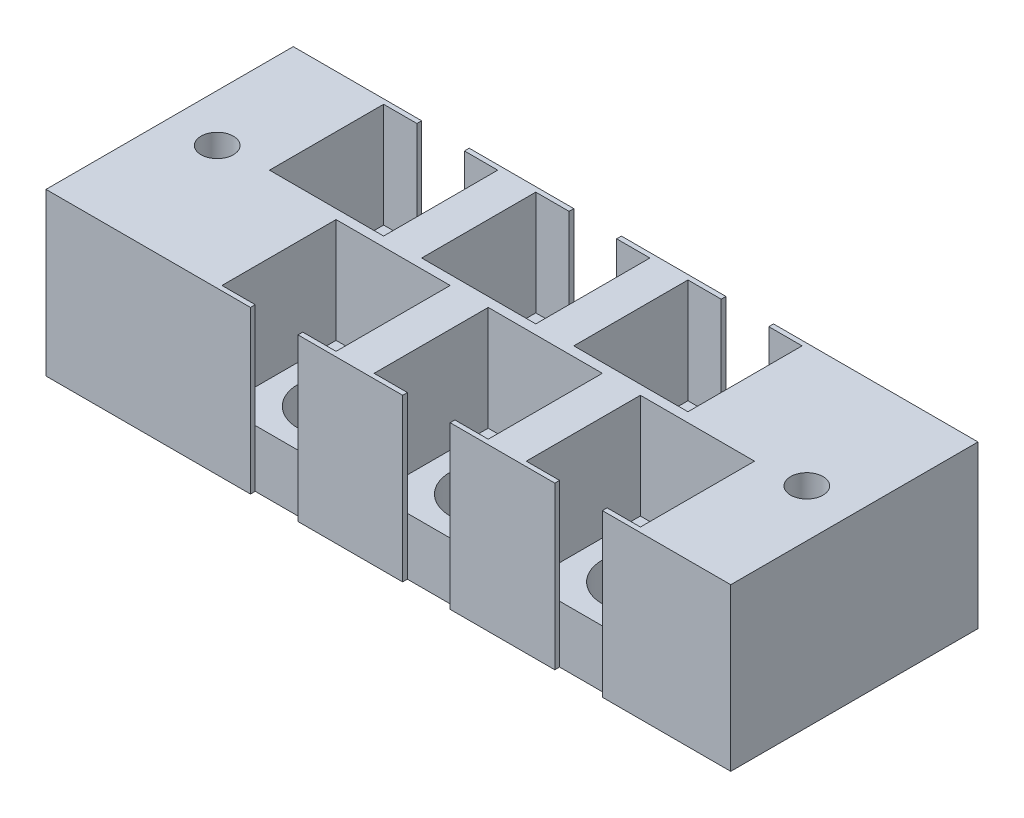
from build123d import *

# Parameters (mm, degrees)
SKETCH1_W             = 12
SKETCH1_H             = 12
SKETCH1_R             = 4
BOSS_EXTRUDE1_DEPTH   = 6
BOSS_EXTRUDE1_2_DEPTH = 6
BOSS_EXTRUDE1_3_DEPTH = 6
BOSS_EXTRUDE1_4_DEPTH = 6
BOSS_EXTRUDE1_5_DEPTH = 6
BOSS_EXTRUDE1_6_DEPTH = 6
SKETCH1_3_R           = 1.7
BOSS_EXTRUDE2_DEPTH   = 17
SKETCH2_W             = 2.2
SKETCH2_H             = 5.000000011
SKETCH2_H_2           = 5.00000001
BOSS_EXTRUDE3_DEPTH   = 7
CUT_EXTRUDE1_DEPTH    = 1


with BuildPart() as part:
    # Sketch1 → Boss-Extrude1 (new body)
    with BuildSketch(Plane(origin=(0, 0, 0), x_dir=(1, 0, 0), z_dir=(0, 1, 0))):
        with Locations((-3.313604998, -10.664874546)):
            Rectangle(SKETCH1_W, SKETCH1_H)
        with Locations((-3.313604998, -10.664874546)):
            Circle(SKETCH1_R, mode=Mode.SUBTRACT)
    extrude(amount=BOSS_EXTRUDE1_DEPTH)



with BuildPart() as body_2:
    # Sketch1 → Boss-Extrude1 2 (new body)
    with BuildSketch(Plane(origin=(0, 0, 0), x_dir=(1, 0, 0), z_dir=(0, 1, 0))):
        with Locations((12.686395002, -10.664873855)):
            Rectangle(SKETCH1_W, SKETCH1_H)
        with Locations((12.686395002, -10.664873855)):
            Circle(SKETCH1_R, mode=Mode.SUBTRACT)
    extrude(amount=BOSS_EXTRUDE1_2_DEPTH)


with BuildPart() as body_3:
    # Sketch1 → Boss-Extrude1 3 (new body)
    with BuildSketch(Plane(origin=(0, 0, 0), x_dir=(1, 0, 0), z_dir=(0, 1, 0))):
        with Locations((4.686395002, -23.66487344)):
            Rectangle(SKETCH1_W, SKETCH1_H)
        with Locations((4.686395002, -23.66487344)):
            Circle(SKETCH1_R, mode=Mode.SUBTRACT)
    extrude(amount=BOSS_EXTRUDE1_3_DEPTH)


with BuildPart() as body_4:
    # Sketch1 → Boss-Extrude1 4 (new body)
    with BuildSketch(Plane(origin=(0, 0, 0), x_dir=(1, 0, 0), z_dir=(0, 1, 0))):
        with Locations((20.686395002, -23.664873826)):
            Rectangle(SKETCH1_W, SKETCH1_H)
        with Locations((20.686395002, -23.664873826)):
            Circle(SKETCH1_R, mode=Mode.SUBTRACT)
    extrude(amount=BOSS_EXTRUDE1_4_DEPTH)


with BuildPart() as body_5:
    # Sketch1 → Boss-Extrude1 5 (new body)
    with BuildSketch(Plane(origin=(0, 0, 0), x_dir=(1, 0, 0), z_dir=(0, 1, 0))):
        with Locations((28.686395002, -10.664873798)):
            Rectangle(SKETCH1_W, SKETCH1_H)
        with Locations((28.686395002, -10.664873798)):
            Circle(SKETCH1_R, mode=Mode.SUBTRACT)
    extrude(amount=BOSS_EXTRUDE1_5_DEPTH)


with BuildPart() as body_6:
    # Sketch1 → Boss-Extrude1 6 (new body)
    with BuildSketch(Plane(origin=(0, 0, 0), x_dir=(1, 0, 0), z_dir=(0, 1, 0))):
        with Locations((36.686395002, -23.664873963)):
            Rectangle(SKETCH1_W, SKETCH1_H)
        with Locations((36.686395002, -23.664873963)):
            Circle(SKETCH1_R, mode=Mode.SUBTRACT)
    extrude(amount=BOSS_EXTRUDE1_6_DEPTH)


with BuildPart() as part_1:
    add(part.part)

    add(body_2.part)  # Boss-Extrude2 merges body 2

    add(body_3.part)  # Boss-Extrude2 merges body 3

    add(body_4.part)  # Boss-Extrude2 merges body 4

    add(body_5.part)  # Boss-Extrude2 merges body 5

    add(body_6.part)  # Boss-Extrude2 merges body 6
    # Sketch1<3> → Boss-Extrude2 (add)
    with BuildSketch(Plane(origin=(0, 0, 0), x_dir=(1, 0, 0), z_dir=(0, 1, 0))):
        Polygon((6.186395002, -4.164873855), (3.186395002, -4.164874546), (-0.813604998, -4.164874546), (-0.813604998, -4.664874546), (2.686395002, -4.664874546), (2.686395002, -16.664874546), (-9.313604998, -16.664874546), (-9.313604998, -4.664874546), (-5.813604998, -4.664874546), (-5.813604998, -4.164874546), (-19.313604998, -4.164874546), (-19.313604998, -30.16487344), (2.186395002, -30.16487344), (2.186395002, -29.66487344), (-1.313604998, -29.66487344), (-1.313604998, -17.66487344), (10.686395002, -17.66487344), (10.686395002, -29.66487344), (7.186395002, -29.66487344), (7.186395002, -30.16487344), (11.186395002, -30.16487344), (14.186395002, -30.164873826), (18.186395002, -30.164873826), (18.186395002, -29.664873826), (14.686395002, -29.664873826), (14.686395002, -17.664873826), (26.686395002, -17.664873826), (26.686395002, -29.664873826), (23.186395002, -29.664873826), (23.186395002, -30.164873826), (27.186395002, -30.164873826), (30.186395002, -30.164873963), (34.186395002, -30.164873963), (34.186395002, -29.664873963), (30.686395002, -29.664873963), (30.686395002, -17.664873963), (42.686395002, -17.664873963), (42.686395002, -29.664873963), (39.186395002, -29.664873963), (39.186395002, -30.164873963), (43.186395002, -30.164873963), (52.686395002, -30.16487344), (52.686395002, -4.164874546), (35.186395002, -4.164873798), (31.186395002, -4.164873798), (31.186395002, -4.664873798), (34.686395002, -4.664873798), (34.686395002, -16.664873798), (22.686395002, -16.664873798), (22.686395002, -4.664873798), (26.186395002, -4.664873798), (26.186395002, -4.164873798), (22.186395002, -4.164873798), (19.186395002, -4.164873855), (15.186395002, -4.164873855), (15.186395002, -4.664873855), (18.686395002, -4.664873855), (18.686395002, -16.664873855), (6.686395002, -16.664873855), (6.686395002, -4.664873855), (10.186395002, -4.664873855), (10.186395002, -4.164873855), align=None)
        with Locations((-14.313604998, -17.164873993)):
            Circle(SKETCH1_3_R, mode=Mode.SUBTRACT)
        with Locations((47.686395002, -17.164873993)):
            Circle(SKETCH1_3_R, mode=Mode.SUBTRACT)
    extrude(amount=BOSS_EXTRUDE2_DEPTH)

    # Sketch2 → Boss-Extrude3 (add)
    with BuildSketch(Plane.XZ):
        with Locations((0.286395002, 17.164875484)):
            Rectangle(SKETCH2_W, SKETCH2_H)
        with Locations((9.086395002, 17.164872919)):
            Rectangle(SKETCH2_W, SKETCH2_H_2)
        with Locations((16.286395002, 17.164872919)):
            Rectangle(SKETCH2_W, SKETCH2_H_2)
        with Locations((25.086395002, 17.164870999)):
            Rectangle(SKETCH2_W, SKETCH2_H_2)
        with Locations((32.286395002, 17.164870999)):
            Rectangle(SKETCH2_W, SKETCH2_H_2)
    extrude(amount=BOSS_EXTRUDE3_DEPTH)

    # Sketch3 → Cut-Extrude1 (cut)
    # profile 1 of 2: a face of its own
    with BuildSketch(Plane.XZ):
        Polygon((-9.398255556, 27.603725947), (-7.851460684, 27.603725947), (-7.851460684, 27.278084921), (-9.113319659, 27.278084921), (-9.113319659, 26.301161844), (-7.851460684, 26.301161844), (-7.851460684, 25.975520819), (-9.113319659, 25.975520819), (-9.113319659, 24.428725947), (-9.398255556, 24.428725947), align=None)
    # profile 2 of 2: a face of its own
    with BuildSketch(Plane.XZ):
        with BuildLine():
            Line((-6.101140171, 27.685136203), (-5.881078072, 27.512775426))
            Line((-5.881078072, 27.512775426), (-6.719985324, 26.22992787))
            add(Edge.make_bspline(
                [(-6.719985324, 26.22992787), (-6.664132287, 26.238830444), (-6.555184623, 26.25619592), (-6.444906986, 26.259060628), (-6.39116421, 26.260456716)],
                knots=[0, 0, 0, 0, 1.025318673, 2, 2, 2, 2], degree=3))
            add(Edge.make_bspline(
                [(-6.39116421, 26.260456716), (-6.35889325, 26.259601948), (-6.295578934, 26.257924928), (-6.202547412, 26.244671952), (-6.113132706, 26.224043768), (-6.027534286, 26.193853167), (-5.945643518, 26.155299567), (-5.866992134, 26.109090163), (-5.793058147, 26.05284231), (-5.722889583, 25.990009056), (-5.659183571, 25.920415803), (-5.602781007, 25.846573159), (-5.555403846, 25.768558075), (-5.516964646, 25.686410061), (-5.48711522, 25.600255747), (-5.465354999, 25.510205363), (-5.452492083, 25.416196814), (-5.450745388, 25.352263041), (-5.44985812, 25.319786644)],
                knots=[0, 0, 0, 0, 1.044136307, 2.048553127, 3.035567123, 4.010001674, 4.980053131, 5.96154148, 6.956538004, 7.981742224, 9.006487041, 10.005615874, 10.984750588, 11.954802044, 12.935714515, 13.930994945, 14.949008866, 16, 16, 16, 16], degree=3))
            add(Edge.make_bspline(
                [(-5.44985812, 25.319786644), (-5.45114908, 25.275355055), (-5.453689382, 25.187924204), (-5.479002111, 25.060582478), (-5.518335504, 24.939267981), (-5.574557976, 24.825917605), (-5.644391995, 24.720686702), (-5.729552382, 24.627445601), (-5.827018975, 24.544287782), (-5.937224856, 24.474749277), (-6.055827402, 24.417959367), (-6.180425286, 24.377169469), (-6.309808483, 24.352056607), (-6.397624092, 24.348908275), (-6.44204562, 24.347315691)],
                knots=[0, 0, 0, 0, 1.031375318, 2.029502543, 3.004789286, 3.987476834, 4.960371455, 5.9300674, 6.912260825, 7.929083631, 8.949397511, 9.960523116, 10.96833055, 12, 12, 12, 12], degree=3))
            add(Edge.make_bspline(
                [(-6.44204562, 24.347315691), (-6.484769056, 24.348701991), (-6.569396701, 24.351448011), (-6.69388645, 24.375909969), (-6.813505045, 24.415558555), (-6.927414412, 24.470181508), (-7.032933825, 24.539176873), (-7.127336224, 24.62223694), (-7.210150905, 24.717586241), (-7.27907074, 24.825209984), (-7.333734018, 24.940861589), (-7.374727736, 25.061454581), (-7.398672899, 25.186549564), (-7.402018947, 25.271350312), (-7.403704274, 25.314062485)],
                knots=[0, 0, 0, 0, 1.012016664, 2.004627821, 2.994792927, 3.992885782, 4.990978636, 5.973936114, 6.964471063, 7.975201453, 8.993600317, 9.990122807, 10.98767138, 12, 12, 12, 12], degree=3))
            add(Edge.make_bspline(
                [(-7.403704274, 25.314062485), (-7.402632535, 25.346760072), (-7.400444248, 25.413522295), (-7.385164886, 25.514636092), (-7.360613251, 25.618096716), (-7.333117528, 25.705866592), (-7.304065724, 25.777768115), (-7.279888063, 25.83573771), (-7.24979451, 25.895392398), (-7.2177058, 25.958777768), (-7.180733497, 26.024260268), (-7.140532872, 26.092934311), (-7.095992475, 26.163707716), (-7.06476847, 26.211735665), (-7.048806437, 26.236288046)],
                knots=[0, 0, 0, 0, 1.173818275, 2.396712641, 3.66331629, 4.989737886, 5.693666774, 6.447286557, 7.243889047, 8.091586357, 8.998013824, 9.943181721, 10.948533338, 12, 12, 12, 12], degree=3))
            Line((-7.048806437, 26.236288046), (-6.101140171, 27.685136203))
        make_face()
        with BuildLine():
            add(Edge.make_bspline(
                [(-6.450949867, 25.934815691), (-6.475135558, 25.934100528), (-6.522587686, 25.932697384), (-6.592119241, 25.924772831), (-6.657747726, 25.909756715), (-6.720227068, 25.890337031), (-6.778890376, 25.863880994), (-6.834464891, 25.832179146), (-6.886310979, 25.794197549), (-6.934175557, 25.751320613), (-6.977549888, 25.704333064), (-7.014908341, 25.654016471), (-7.0471319, 25.601570163), (-7.073331923, 25.546559408), (-7.093733611, 25.489004329), (-7.108491245, 25.429169877), (-7.116704289, 25.366654754), (-7.118070657, 25.324261698), (-7.118768377, 25.302614168)],
                knots=[0, 0, 0, 0, 1.128956033, 2.215002439, 3.259141796, 4.2666399, 5.263148119, 6.255916712, 7.247353359, 8.256307737, 9.250603402, 10.226115518, 11.176314381, 12.118911324, 13.063945463, 14.021379252, 14.989639887, 16, 16, 16, 16], degree=3))
            add(Edge.make_bspline(
                [(-7.118768377, 25.302614168), (-7.118200177, 25.281160258), (-7.117086023, 25.239092334), (-7.106969276, 25.177098935), (-7.091516022, 25.117440768), (-7.068528663, 25.060425389), (-7.041108558, 25.005183729), (-7.004908728, 24.95371672), (-6.964797786, 24.902898514), (-6.916851718, 24.856632893), (-6.865395525, 24.813582956), (-6.810421577, 24.77595444), (-6.75312647, 24.743763411), (-6.69273668, 24.718534773), (-6.630109003, 24.697829884), (-6.564721643, 24.683259828), (-6.496529125, 24.675022493), (-6.450335652, 24.673654346), (-6.426781197, 24.672956716)],
                knots=[0, 0, 0, 0, 0.989467248, 1.94019797, 2.891935182, 3.827694429, 4.772920941, 5.730924762, 6.725747692, 7.756678648, 8.79901574, 9.819492441, 10.826891316, 11.826466727, 12.835195252, 13.867842842, 14.912794438, 16, 16, 16, 16], degree=3))
            add(Edge.make_bspline(
                [(-6.426781197, 24.672956716), (-6.403226781, 24.673654401), (-6.357033384, 24.675022655), (-6.288840316, 24.683259212), (-6.223454985, 24.697832143), (-6.160819937, 24.718526584), (-6.100457354, 24.743793787), (-6.043212356, 24.775754172), (-5.9887583, 24.813814364), (-5.937268327, 24.856559324), (-5.889521826, 24.90316184), (-5.848448866, 24.953263088), (-5.813357647, 25.005599693), (-5.784842349, 25.060207779), (-5.762108178, 25.117475243), (-5.746576561, 25.177089699), (-5.736480706, 25.239094751), (-5.735363681, 25.281161074), (-5.734794018, 25.302614168)],
                knots=[0, 0, 0, 0, 1.087397944, 2.132534446, 3.165364764, 4.174271784, 5.174024072, 6.181601208, 7.194203697, 8.236725232, 9.267838612, 10.269026844, 11.221737037, 12.171628256, 13.107553087, 14.05945871, 15.010357665, 16, 16, 16, 16], degree=3))
            add(Edge.make_bspline(
                [(-5.734794018, 25.302614168), (-5.735293213, 25.324289938), (-5.73627297, 25.366832426), (-5.747354571, 25.429141922), (-5.762723759, 25.489308307), (-5.785931097, 25.546953757), (-5.816081867, 25.601849602), (-5.852804263, 25.654277717), (-5.895295301, 25.704622251), (-5.944341412, 25.751441048), (-5.997731854, 25.793933192), (-6.05413902, 25.832321734), (-6.113913967, 25.863585902), (-6.175978195, 25.890427016), (-6.24107925, 25.909448889), (-6.308506046, 25.924819714), (-6.378897492, 25.932631138), (-6.426766329, 25.934082471), (-6.450949867, 25.934815691)],
                knots=[0, 0, 0, 0, 0.978753431, 1.920974676, 2.853199117, 3.782215702, 4.721507756, 5.67862441, 6.671401678, 7.694929396, 8.738190014, 9.75360867, 10.774035531, 11.783329636, 12.805060902, 13.835252836, 14.906360638, 16, 16, 16, 16], degree=3))
        make_face(mode=Mode.SUBTRACT)
    extrude(amount=-CUT_EXTRUDE1_DEPTH, mode=Mode.SUBTRACT)


solid = part_1.part
